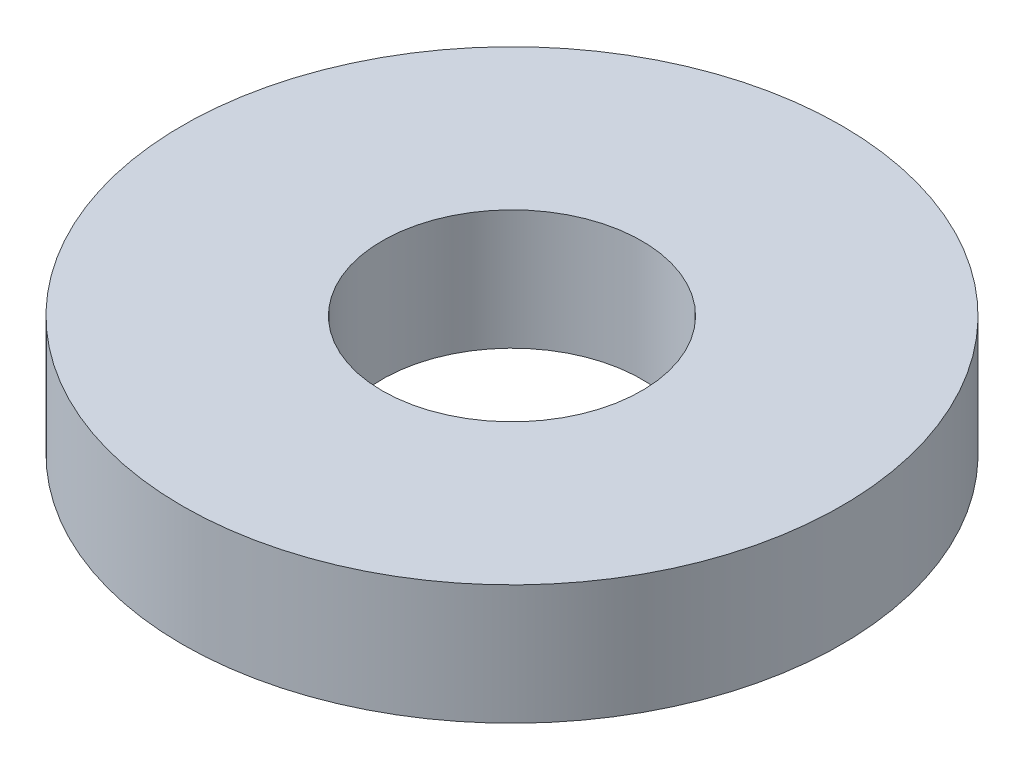
from build123d import *

# Parameters (mm, degrees)
SKETCH1_R           = 82.5
BOSS_EXTRUDE1_DEPTH = 30
SKETCH2_R           = 32.5
CUT_EXTRUDE1_DEPTH  = 121.467838032


with BuildPart() as part:
    # Sketch1 → Boss-Extrude1 (new body)
    with BuildSketch(Plane(origin=(0, 0, 0), x_dir=(1, 0, 0), z_dir=(0, 1, 0))):
        Circle(SKETCH1_R)
    extrude(amount=BOSS_EXTRUDE1_DEPTH)

    # Sketch2 → Cut-Extrude1 (cut, through all)
    with BuildSketch(Plane(origin=(0, 0, 0), x_dir=(1, 0, 0), z_dir=(0, 1, 0))):
        Circle(SKETCH2_R)
    extrude(amount=CUT_EXTRUDE1_DEPTH, mode=Mode.SUBTRACT)


solid = part.part
